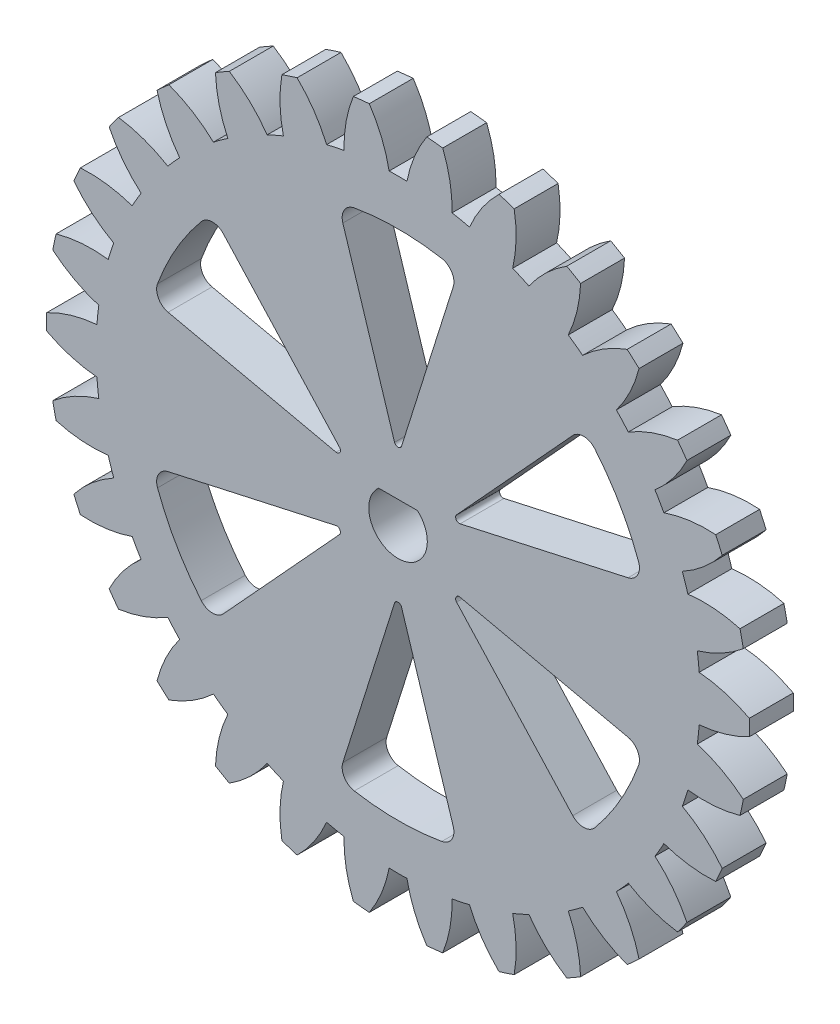
from build123d import *

# Parameters (mm, degrees)
SKETCH1_R                = 24
BOSS_EXTRUDE1_DEPTH      = 3
CUT_EXTRUDE1_DEPTH       = 35.073450075
CIRPATTERN1_COUNT        = 30
CUT_EXTRUDE7_DEPTH       = 10
CUT_EXTRUDE8_DEPTH       = 35.016744977
FILLET1_R                = 1
FILLET2_R                = 0.25
CIRPATTERN2_COUNT        = 6
FILLET1_OF_CIRPATTERN2_R = 1
FILLET2_OF_CIRPATTERN2_R = 0.25


with BuildPart() as part:
    # Sketch1 → Boss-Extrude1 (new body)
    with BuildSketch(Plane.XY):
        Circle(SKETCH1_R)
    extrude(amount=BOSS_EXTRUDE1_DEPTH)

    # Sketch3 → Cut-Extrude1 (cut, through all)
    with BuildSketch(Plane.XY.offset(3)):
        with BuildLine():
            ThreePointArc((-1.964958318, 23.919425972), (-1.120930048, 22.335720311), (-0.607894329, 20.616039617))
            ThreePointArc((-0.607894329, 20.616039617), (0, 20.625), (0.607894329, 20.616039617))
            ThreePointArc((0.607894329, 20.616039617), (1.120930048, 22.335720311), (1.964958318, 23.919425972))
            ThreePointArc((1.964958318, 23.919425972), (0, 24), (-1.964958318, 23.919425972))
        make_face()
    cut_extrude1 = extrude(amount=-CUT_EXTRUDE1_DEPTH, mode=Mode.SUBTRACT)

    # CirPattern1: Cut-Extrude1 ×30 about axis
    cirpattern1_axis = Axis((0, 0, 3), (0, 0, -1))
    for i in range(1, CIRPATTERN1_COUNT):
        add(cut_extrude1.rotate(cirpattern1_axis, i * 360 / CIRPATTERN1_COUNT), mode=Mode.SUBTRACT)

    # Sketch9 → Cut-Extrude7 (cut)
    with BuildSketch(Plane.XY.offset(3)):
        with BuildLine():
            Line((-1.322875656, 1.5), (1.322875656, 1.5))
            ThreePointArc((1.322875656, 1.5), (0, -2), (-1.322875656, 1.5))
        make_face()
    extrude(amount=-CUT_EXTRUDE7_DEPTH, mode=Mode.SUBTRACT)

    # Sketch10 → Cut-Extrude8 (cut, symmetric)
    with BuildSketch(Plane.XY.offset(3)):
        with BuildLine():
            Line((0, 4), (-4.102753725, 17.01227239))
            ThreePointArc((-4.102753725, 17.01227239), (0, 17.5), (4.102753725, 17.01227239))
            Line((4.102753725, 17.01227239), (0, 4))
        make_face()
    cut_extrude8 = extrude(amount=CUT_EXTRUDE8_DEPTH, both=True, mode=Mode.SUBTRACT)

    # Fillet1
    fillet1_edges = [part.edges().sort_by_distance(p)[0] for p in [
        (4.102753725, 17.01227239, 1.5),
        (-4.102753725, 17.01227239, 1.5),
    ]]
    fillet(fillet1_edges, radius=FILLET1_R)

    # Fillet2
    fillet2_edges = [part.edges().sort_by_distance(p)[0] for p in [
        (0, 4, 1.5),
    ]]
    fillet(fillet2_edges, radius=FILLET2_R)

    # CirPattern2: Cut-Extrude8 ×6 about axis
    cirpattern2_axis = Axis((0, 0, 3), (0, 0, 1))
    for i in range(1, CIRPATTERN2_COUNT):
        add(cut_extrude8.rotate(cirpattern2_axis, i * 360 / CIRPATTERN2_COUNT), mode=Mode.SUBTRACT)

    # Fillet1 of CirPattern2
    fillet1_of_cirpattern2_edges = [part.edges().sort_by_distance(p)[0] for p in [
        (-12.681683203, 12.059225146, 1.5),
        (-16.784436928, 4.953047244, 1.5),
        (-16.784436928, -4.953047244, 1.5),
        (-12.681683203, -12.059225146, 1.5),
        (-4.102753725, -17.01227239, 1.5),
        (4.102753725, -17.01227239, 1.5),
        (12.681683203, -12.059225146, 1.5),
        (16.784436928, -4.953047244, 1.5),
        (16.784436928, 4.953047244, 1.5),
        (12.681683203, 12.059225146, 1.5),
    ]]
    fillet(fillet1_of_cirpattern2_edges, radius=FILLET1_OF_CIRPATTERN2_R)

    # Fillet2 of CirPattern2
    fillet2_of_cirpattern2_edges = [part.edges().sort_by_distance(p)[0] for p in [
        (-3.464101615, 2, 1.5),
        (-3.464101615, -2, 1.5),
        (0, -4, 1.5),
        (3.464101615, -2, 1.5),
        (3.464101615, 2, 1.5),
    ]]
    fillet(fillet2_of_cirpattern2_edges, radius=FILLET2_OF_CIRPATTERN2_R)


solid = part.part
